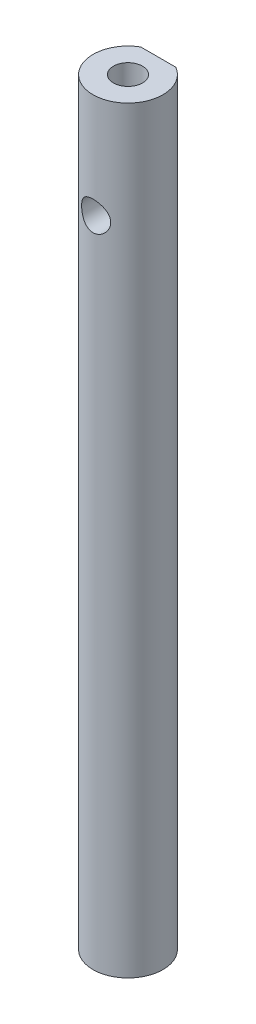
from build123d import *

# Parameters (mm, degrees)
SKETCH_1_R             = 3
EXTRUDE_2_DEPTH        = 65
SKETCH_2_W             = 3
SKETCH_2_H             = 4.753372532
CUT_EXTRUDE_1_DEPTH    = 12
HOLE_WIZARD_M3_1_D     = 2.5
HOLE_WIZARD_M3_2_D     = 2.5
HOLE_WIZARD_M3_2_DEPTH = 6
HOLE_WIZARD_M3_2_TIP   = 0.751075774


with BuildPart() as part:
    # 草图1 → 凸台-拉伸2 (new body)
    with BuildSketch(Plane(origin=(0, 0, 0), x_dir=(1, 0, 0), z_dir=(0, 1, 0))):
        Circle(SKETCH_1_R)
    extrude(amount=EXTRUDE_2_DEPTH)

    # 草图2 → 切除-拉伸1 (cut)
    with BuildSketch(Plane(origin=(0, 65, 0), x_dir=(1, 0, 0), z_dir=(0, 1, 0))):
        with Locations((0, 4.974762477)):
            Rectangle(SKETCH_2_W, SKETCH_2_H)
    extrude(amount=-CUT_EXTRUDE_1_DEPTH, mode=Mode.SUBTRACT)

    # M3 螺纹孔1 (through all)
    with Locations(Plane(origin=(0, 0, -2.598076211), x_dir=(-1, 0, 0), z_dir=(0, 0, -1))):
        with Locations((0, 56)):
            Hole(HOLE_WIZARD_M3_1_D / 2)

    # M3 螺纹孔2
    with Locations(Plane(origin=(0, 65, 0), x_dir=(1, 0, 0), z_dir=(0, 1, 0))):
        with Locations((0, 0)):
            Hole(HOLE_WIZARD_M3_2_D / 2, depth=HOLE_WIZARD_M3_2_DEPTH)
            with Locations((0, 0, -(HOLE_WIZARD_M3_2_DEPTH + HOLE_WIZARD_M3_2_TIP / 2))):  # 118° drill point
                Cone(0, HOLE_WIZARD_M3_2_D / 2, HOLE_WIZARD_M3_2_TIP, mode=Mode.SUBTRACT)


solid = part.part
